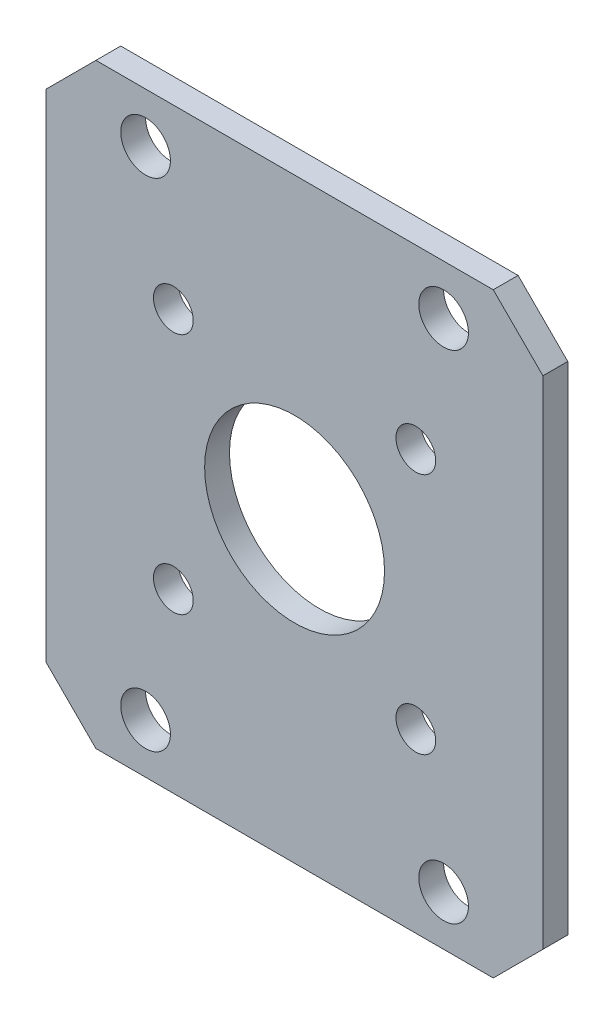
from build123d import *

# Parameters (mm, degrees)
SKETCH1_W           = 63.5
SKETCH1_H           = 76.2
BOSS_EXTRUDE1_DEPTH = 1.5875
SKETCH2_R           = 3.175
CUT_EXTRUDE1_DEPTH  = 50.6966108
SKETCH3_R           = 2.54
CUT_EXTRUDE2_DEPTH  = 50.6966108
CHAMFER1_SIZE       = 6.35
SKETCH4_R           = 11.5
CUT_EXTRUDE3_DEPTH  = 50.6966108


with BuildPart() as part:
    # Sketch1 → Boss-Extrude1 (new, symmetric)
    with BuildSketch(Plane.XY):
        Rectangle(SKETCH1_W, SKETCH1_H)
    extrude(amount=BOSS_EXTRUDE1_DEPTH, both=True)

    # Sketch2 → Cut-Extrude1 (cut, through all)
    with BuildSketch(Plane.XY.offset(1.5875)):
        with Locations((-19.05, 31.75)):
            Circle(SKETCH2_R)
        with Locations((19.05, 31.75)):
            Circle(SKETCH2_R)
        with Locations((19.05, -31.75)):
            Circle(SKETCH2_R)
        with Locations((-19.05, -31.75)):
            Circle(SKETCH2_R)
    extrude(amount=-CUT_EXTRUDE1_DEPTH, mode=Mode.SUBTRACT)

    # Sketch3 → Cut-Extrude2 (cut, through all)
    with BuildSketch(Plane.XY.offset(1.5875)):
        with Locations((-15.5, 15.5)):
            Circle(SKETCH3_R)
        with Locations((15.5, 15.5)):
            Circle(SKETCH3_R)
        with Locations((15.5, -15.5)):
            Circle(SKETCH3_R)
        with Locations((-15.5, -15.5)):
            Circle(SKETCH3_R)
    extrude(amount=-CUT_EXTRUDE2_DEPTH, mode=Mode.SUBTRACT)

    # Chamfer1
    chamfer1_edges = [part.edges().sort_by_distance(p)[0] for p in [
        (-31.75, -38.1, 0),
        (31.75, -38.1, 0),
        (31.75, 38.1, 0),
        (-31.75, 38.1, 0),
    ]]
    chamfer(chamfer1_edges, length=CHAMFER1_SIZE)

    # Sketch4 → Cut-Extrude3 (cut, through all)
    with BuildSketch(Plane.XY.offset(1.5875)):
        Circle(SKETCH4_R)
    extrude(amount=-CUT_EXTRUDE3_DEPTH, mode=Mode.SUBTRACT)


solid = part.part
